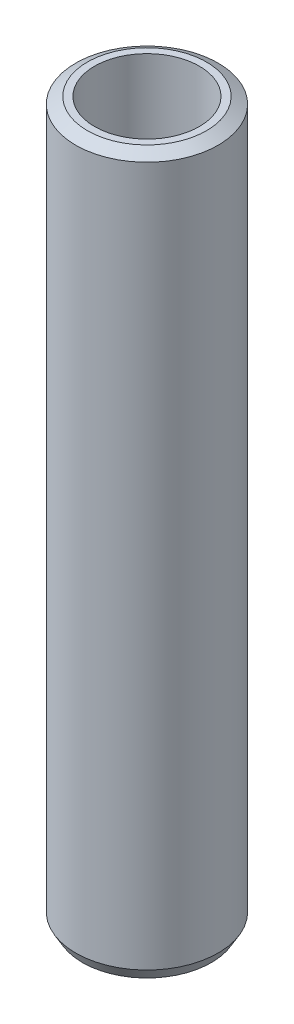
from build123d import *
from OCP.BRepFilletAPI import BRepFilletAPI_MakeChamfer

# Parameters (mm, degrees)
SKETCH1_R           = 52.5
BOSS_EXTRUDE1_DEPTH = 529.359882505
SKETCH2_R           = 38.620565734
CUT_EXTRUDE1_DEPTH  = 535.541284847
CHAMFER1_SIZE       = 4.965635489
CHAMFER1_SIZE2      = 8.600732958


with BuildPart() as part:
    # Sketch1 → Boss-Extrude1 (new body)
    with BuildSketch(Plane(origin=(0, 0, 0), x_dir=(1, 0, 0), z_dir=(0, 1, 0))):
        Circle(SKETCH1_R)
    extrude(amount=BOSS_EXTRUDE1_DEPTH)

    # Sketch2 → Cut-Extrude1 (cut, through all)
    with BuildSketch(Plane(origin=(0, 0, 0), x_dir=(1, 0, 0), z_dir=(0, 1, 0))):
        Circle(SKETCH2_R)
    extrude(amount=CUT_EXTRUDE1_DEPTH, mode=Mode.SUBTRACT)

    # Chamfer1: one chamfer whose edges measure the first distance from different faces: ONE call of the kernel's chamfer builder (chamfer() names one face for all edges)
    chamfer1_edges_1 = [part.edges().sort_by_distance(p)[0] for p in [
        (-52.5, 529.359882505, 0),
    ]]
    chamfer1_side_1 = [part.faces().sort_by_distance(p)[0] for p in [
        (-52.5, 264.679941252, 0),
    ]]
    chamfer1_edges_2 = [part.edges().sort_by_distance(p)[0] for p in [
        (-52.5, 0, 0),
    ]]
    chamfer1_side_2 = [part.faces().sort_by_distance(p)[0] for p in [
        (-51.01507576, 0, 0),
    ]]
    chamfer1 = BRepFilletAPI_MakeChamfer(part.part.solid().wrapped)
    for e in chamfer1_edges_1:
        chamfer1.Add(CHAMFER1_SIZE, CHAMFER1_SIZE2, e.wrapped, chamfer1_side_1[0].wrapped)  # the first distance lies on this face
    for e in chamfer1_edges_2:
        chamfer1.Add(CHAMFER1_SIZE, CHAMFER1_SIZE2, e.wrapped, chamfer1_side_2[0].wrapped)  # the first distance lies on this face
    add(Compound.cast(chamfer1.Shape()), mode=Mode.REPLACE)


solid = part.part
